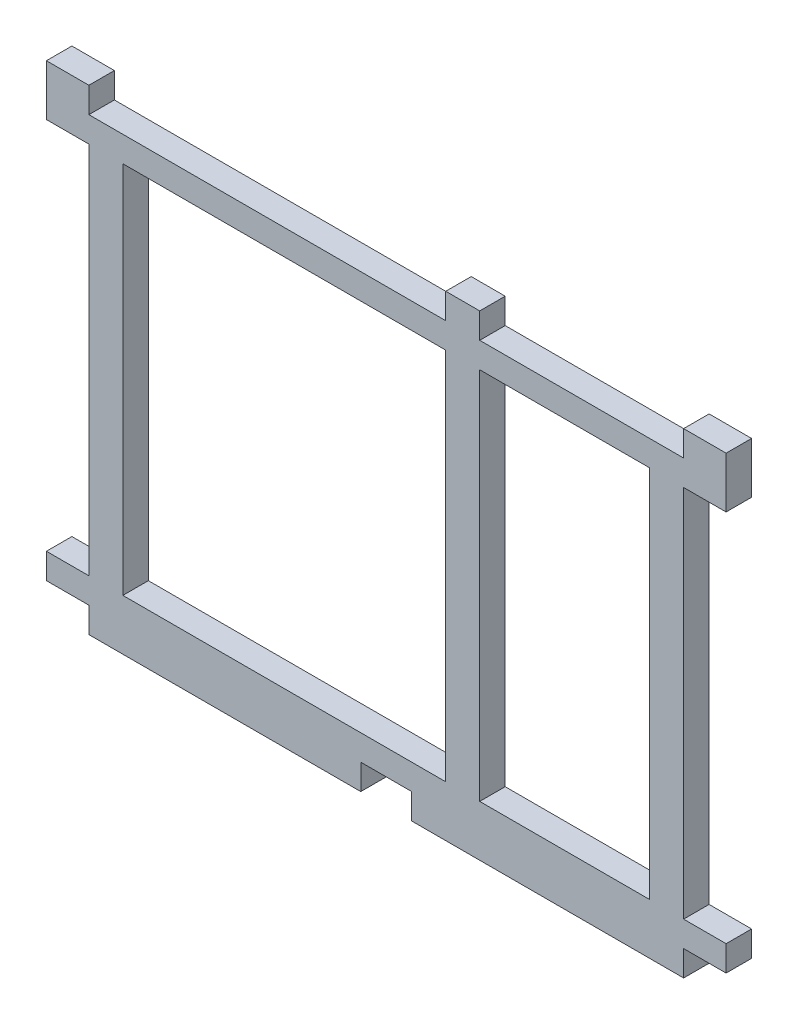
from build123d import *

# Parameters (mm, degrees)
SKETCH1_W           = 38
SKETCH1_H           = 44
SKETCH1_W_2         = 20
BOSS_EXTRUDE1_DEPTH = 3


with BuildPart() as part:
    # Sketch1 → Boss-Extrude1 (new body)
    with BuildSketch(Plane.XY):
        Polygon((-41.282447519, 37.190929465), (-36.282447519, 37.190929465), (-36.282447519, -6.809070535), (-41.282447519, -6.809070535), (-41.282447519, -9.809070535), (-36.282447519, -9.809070535), (-36.282447519, -12.809070535), (-4.282447519, -12.809070535), (-4.282447519, -9.809070535), (1.717552481, -9.809070535), (1.717552481, -12.809070535), (33.717552481, -12.809070535), (33.717552481, -9.809070535), (38.717552481, -9.809070535), (38.717552481, -6.809070535), (33.717552481, -6.809070535), (33.717552481, 37.190929465), (38.717552481, 37.190929465), (38.717552481, 43.190929465), (33.717552481, 43.190929465), (33.717552481, 40.190929465), (9.717552481, 40.190929465), (9.717552481, 43.190929465), (5.717552481, 43.190929465), (5.717552481, 40.190929465), (-36.282447519, 40.190929465), (-36.282447519, 43.190929465), (-41.282447519, 43.190929465), align=None)
        with Locations((-13.282447519, 15.190929465)):
            Rectangle(SKETCH1_W, SKETCH1_H, mode=Mode.SUBTRACT)
        with Locations((19.717552481, 15.190929465)):
            Rectangle(SKETCH1_W_2, SKETCH1_H, mode=Mode.SUBTRACT)
    extrude(amount=BOSS_EXTRUDE1_DEPTH)


solid = part.part
